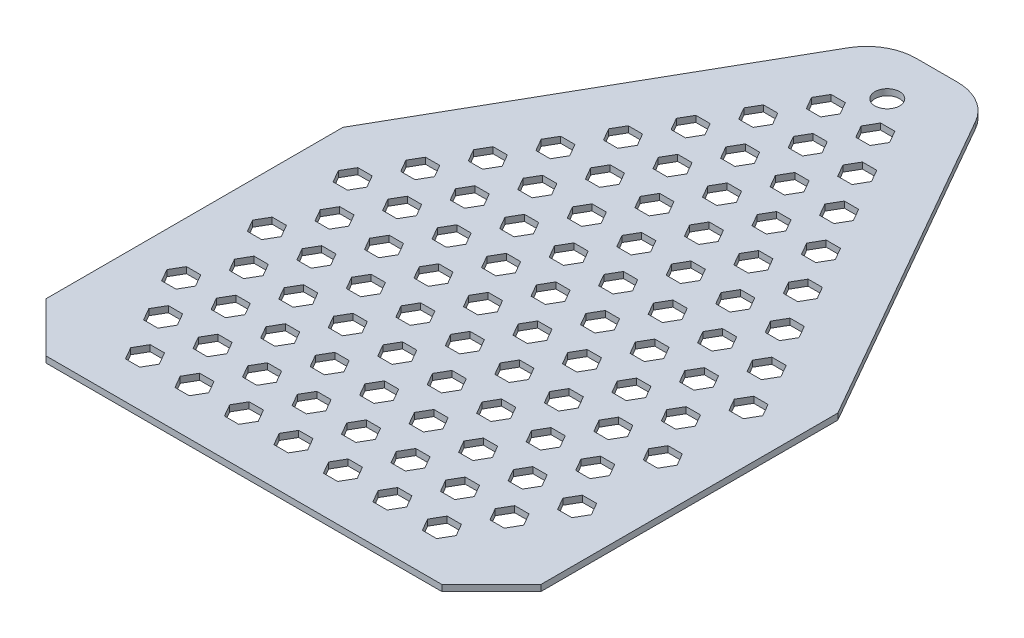
from build123d import *

# Parameters (mm, degrees)
BOSS_EXTRUDE1_DEPTH = 1.5875
CUT_EXTRUDE1_REACH  = 190.806
SKETCH2_R           = 3.175
CUT_EXTRUDE2_REACH  = 190.806
FILL_PATTERN1_DEPTH = 1.5875


# Read off the part's stored shape, not the designer's step: Fill Pattern1
with BuildPart() as part:
    # Sketch1 → Boss-Extrude1 (new body)
    with BuildSketch(Plane(origin=(0, 0, 0), x_dir=(1, 0, 0), z_dir=(0, 1, 0))):
        with BuildLine():
            Line((-50.8, 0), (50.8, 0))
            Line((50.8, 0), (63.5, 12.7))
            Line((63.5, 12.7), (63.5, 88.9))
            Line((63.5, 88.9), (16.356591704, 171.400964517))
            ThreePointArc((16.356591704, 171.400964517), (11.704374391, 176.084358183), (5.3299038, 177.8))
            Line((5.3299038, 177.8), (-5.3299038, 177.8))
            ThreePointArc((-5.3299038, 177.8), (-11.704374391, 176.084358183), (-16.356591704, 171.400964517))
            Line((-16.356591704, 171.400964517), (-63.5, 88.9))
            Line((-63.5, 88.9), (-63.5, 12.7))
            Line((-63.5, 12.7), (-50.8, 0))
        make_face()
    extrude(amount=BOSS_EXTRUDE1_DEPTH)

    # Sketch2 → Cut-Extrude1 (cut, up to next)
    with BuildSketch(Plane(origin=(0, 1.5875, 0), x_dir=(1, 0, 0), z_dir=(0, 1, 0)), mode=Mode.PRIVATE) as cut_extrude1_sk1:
        with Locations(Location((0, 165.1, 0), (0, 0, 270))):
            Circle(SKETCH2_R)
    cut_extrude1_tool1 = extrude(cut_extrude1_sk1.sketch, amount=-CUT_EXTRUDE1_REACH, mode=Mode.PRIVATE) & part.part
    add(cut_extrude1_tool1.solids().sort_by_distance((0, 1.5875, -165.1))[0], mode=Mode.SUBTRACT)

    # Sketch3 → Cut-Extrude2 (cut, up to next)
    with BuildSketch(Plane(origin=(0, 1.5875, 0), x_dir=(1, 0, 0), z_dir=(0, 1, 0)), mode=Mode.PRIVATE) as cut_extrude2_sk1:
        Polygon((1.833087105, 9.525), (3.666174209, 12.7), (1.833087105, 15.875), (-1.833087105, 15.875), (-3.666174209, 12.7), (-1.833087105, 9.525), align=None)
    cut_extrude2_tool1 = extrude(cut_extrude2_sk1.sketch, amount=-CUT_EXTRUDE2_REACH, mode=Mode.PRIVATE) & part.part
    add(cut_extrude2_tool1.solids().sort_by_distance((0, 1.5875, -12.7))[0], mode=Mode.SUBTRACT)

    # Fill Pattern1 outline → Fill Pattern1 (cut)
    with BuildSketch(Plane(origin=(0, 0, 0), x_dir=(1, 0, 0), z_dir=(0, 1, 0))):
        Polygon((9.033825791, 12.7), (10.866912895, 9.525), (14.533087105, 9.525), (16.366174209, 12.7), (14.533087105, 15.875), (10.866912895, 15.875), align=None)
        Polygon((34.433825791, 12.7), (36.266912895, 9.525), (39.933087105, 9.525), (41.766174209, 12.7), (39.933087105, 15.875), (36.266912895, 15.875), align=None)
        Polygon((21.733825791, 12.7), (23.566912895, 9.525), (27.233087105, 9.525), (29.066174209, 12.7), (27.233087105, 15.875), (23.566912895, 15.875), align=None)
        Polygon((-29.066174209, 12.7), (-27.233087105, 9.525), (-23.566912895, 9.525), (-21.733825791, 12.7), (-23.566912895, 15.875), (-27.233087105, 15.875), align=None)
        Polygon((-16.366174209, 12.7), (-14.533087105, 9.525), (-10.866912895, 9.525), (-9.033825791, 12.7), (-10.866912895, 15.875), (-14.533087105, 15.875), align=None)
        Polygon((-41.766174209, 12.7), (-39.933087105, 9.525), (-36.266912895, 9.525), (-34.433825791, 12.7), (-36.266912895, 15.875), (-39.933087105, 15.875), align=None)
        Polygon((-33.583087105, 70.86761314), (-35.416174209, 67.69261314), (-33.583087105, 64.51761314), (-29.916912895, 64.51761314), (-28.083825791, 67.69261314), (-29.916912895, 70.86761314), align=None)
        Polygon((-27.233087105, 59.869090512), (-29.066174209, 56.694090512), (-27.233087105, 53.519090512), (-23.566912895, 53.519090512), (-21.733825791, 56.694090512), (-23.566912895, 59.869090512), align=None)
        Polygon((-46.283087105, 92.864658396), (-48.116174209, 89.689658396), (-46.283087105, 86.514658396), (-42.616912895, 86.514658396), (-40.783825791, 89.689658396), (-42.616912895, 92.864658396), align=None)
        Polygon((-39.933087105, 81.866135768), (-41.766174209, 78.691135768), (-39.933087105, 75.516135768), (-36.266912895, 75.516135768), (-34.433825791, 78.691135768), (-36.266912895, 81.866135768), align=None)
        Polygon((-14.533087105, 37.872045256), (-16.366174209, 34.697045256), (-14.533087105, 31.522045256), (-10.866912895, 31.522045256), (-9.033825791, 34.697045256), (-10.866912895, 37.872045256), align=None)
        Polygon((-8.183087105, 26.873522628), (-10.016174209, 23.698522628), (-8.183087105, 20.523522628), (-4.516912895, 20.523522628), (-2.683825791, 23.698522628), (-4.516912895, 26.873522628), align=None)
        Polygon((-20.883087105, 48.870567884), (-22.716174209, 45.695567884), (-20.883087105, 42.520567884), (-17.216912895, 42.520567884), (-15.383825791, 45.695567884), (-17.216912895, 48.870567884), align=None)
        Polygon((46.283087105, 92.864658396), (42.616912895, 92.864658396), (40.783825791, 89.689658396), (42.616912895, 86.514658396), (46.283087105, 86.514658396), (48.116174209, 89.689658396), align=None)
        Polygon((39.933087105, 81.866135768), (36.266912895, 81.866135768), (34.433825791, 78.691135768), (36.266912895, 75.516135768), (39.933087105, 75.516135768), (41.766174209, 78.691135768), align=None)
        Polygon((33.583087105, 70.86761314), (29.916912895, 70.86761314), (28.083825791, 67.69261314), (29.916912895, 64.51761314), (33.583087105, 64.51761314), (35.416174209, 67.69261314), align=None)
        Polygon((27.233087105, 59.869090512), (23.566912895, 59.869090512), (21.733825791, 56.694090512), (23.566912895, 53.519090512), (27.233087105, 53.519090512), (29.066174209, 56.694090512), align=None)
        Polygon((20.883087105, 48.870567884), (17.216912895, 48.870567884), (15.383825791, 45.695567884), (17.216912895, 42.520567884), (20.883087105, 42.520567884), (22.716174209, 45.695567884), align=None)
        Polygon((14.533087105, 37.872045256), (10.866912895, 37.872045256), (9.033825791, 34.697045256), (10.866912895, 31.522045256), (14.533087105, 31.522045256), (16.366174209, 34.697045256), align=None)
        Polygon((8.183087105, 26.873522628), (4.516912895, 26.873522628), (2.683825791, 23.698522628), (4.516912895, 20.523522628), (8.183087105, 20.523522628), (10.016174209, 23.698522628), align=None)
        Polygon((-54.466174209, 78.691135768), (-52.633087105, 75.516135768), (-48.966912895, 75.516135768), (-47.133825791, 78.691135768), (-48.966912895, 81.866135768), (-52.633087105, 81.866135768), align=None)
        Polygon((21.733825791, 78.691135768), (23.566912895, 75.516135768), (27.233087105, 75.516135768), (29.066174209, 78.691135768), (27.233087105, 81.866135768), (23.566912895, 81.866135768), align=None)
        Polygon((47.133825791, 78.691135768), (48.966912895, 75.516135768), (52.633087105, 75.516135768), (54.466174209, 78.691135768), (52.633087105, 81.866135768), (48.966912895, 81.866135768), align=None)
        Polygon((-29.066174209, 78.691135768), (-27.233087105, 75.516135768), (-23.566912895, 75.516135768), (-21.733825791, 78.691135768), (-23.566912895, 81.866135768), (-27.233087105, 81.866135768), align=None)
        Polygon((9.033825791, 78.691135768), (10.866912895, 75.516135768), (14.533087105, 75.516135768), (16.366174209, 78.691135768), (14.533087105, 81.866135768), (10.866912895, 81.866135768), align=None)
        Polygon((-16.366174209, 78.691135768), (-14.533087105, 75.516135768), (-10.866912895, 75.516135768), (-9.033825791, 78.691135768), (-10.866912895, 81.866135768), (-14.533087105, 81.866135768), align=None)
        Polygon((-3.666174209, 78.691135768), (-1.833087105, 75.516135768), (1.833087105, 75.516135768), (3.666174209, 78.691135768), (1.833087105, 81.866135768), (-1.833087105, 81.866135768), align=None)
        Polygon((-39.933087105, 59.869090512), (-41.766174209, 56.694090512), (-39.933087105, 53.519090512), (-36.266912895, 53.519090512), (-34.433825791, 56.694090512), (-36.266912895, 59.869090512), align=None)
        Polygon((-33.583087105, 48.870567884), (-35.416174209, 45.695567884), (-33.583087105, 42.520567884), (-29.916912895, 42.520567884), (-28.083825791, 45.695567884), (-29.916912895, 48.870567884), align=None)
        Polygon((-46.283087105, 70.86761314), (-48.116174209, 67.69261314), (-46.283087105, 64.51761314), (-42.616912895, 64.51761314), (-40.783825791, 67.69261314), (-42.616912895, 70.86761314), align=None)
        Polygon((-20.883087105, 26.873522628), (-22.716174209, 23.698522628), (-20.883087105, 20.523522628), (-17.216912895, 20.523522628), (-15.383825791, 23.698522628), (-17.216912895, 26.873522628), align=None)
        Polygon((-27.233087105, 37.872045256), (-29.066174209, 34.697045256), (-27.233087105, 31.522045256), (-23.566912895, 31.522045256), (-21.733825791, 34.697045256), (-23.566912895, 37.872045256), align=None)
        Polygon((-17.216912895, 136.858748909), (-20.883087105, 136.858748909), (-22.716174209, 133.683748909), (-20.883087105, 130.508748909), (-17.216912895, 130.508748909), (-15.383825791, 133.683748909), align=None)
        Polygon((-10.866912895, 147.857271537), (-14.533087105, 147.857271537), (-16.366174209, 144.682271537), (-14.533087105, 141.507271537), (-10.866912895, 141.507271537), (-9.033825791, 144.682271537), align=None)
        Polygon((-4.516912895, 158.855794165), (-8.183087105, 158.855794165), (-10.016174209, 155.680794165), (-8.183087105, 152.505794165), (-4.516912895, 152.505794165), (-2.683825791, 155.680794165), align=None)
        Polygon((-23.566912895, 125.860226281), (-27.233087105, 125.860226281), (-29.066174209, 122.685226281), (-27.233087105, 119.510226281), (-23.566912895, 119.510226281), (-21.733825791, 122.685226281), align=None)
        Polygon((-29.916912895, 114.861703653), (-33.583087105, 114.861703653), (-35.416174209, 111.686703653), (-33.583087105, 108.511703653), (-29.916912895, 108.511703653), (-28.083825791, 111.686703653), align=None)
        Polygon((-36.266912895, 103.863181024), (-39.933087105, 103.863181024), (-41.766174209, 100.688181024), (-39.933087105, 97.513181024), (-36.266912895, 97.513181024), (-34.433825791, 100.688181024), align=None)
        Polygon((28.083825791, 45.695567884), (29.916912895, 42.520567884), (33.583087105, 42.520567884), (35.416174209, 45.695567884), (33.583087105, 48.870567884), (29.916912895, 48.870567884), align=None)
        Polygon((40.783825791, 45.695567884), (42.616912895, 42.520567884), (46.283087105, 42.520567884), (48.116174209, 45.695567884), (46.283087105, 48.870567884), (42.616912895, 48.870567884), align=None)
        Polygon((-48.116174209, 45.695567884), (-46.283087105, 42.520567884), (-42.616912895, 42.520567884), (-40.783825791, 45.695567884), (-42.616912895, 48.870567884), (-46.283087105, 48.870567884), align=None)
        Polygon((-10.016174209, 45.695567884), (-8.183087105, 42.520567884), (-4.516912895, 42.520567884), (-2.683825791, 45.695567884), (-4.516912895, 48.870567884), (-8.183087105, 48.870567884), align=None)
        Polygon((2.683825791, 45.695567884), (4.516912895, 42.520567884), (8.183087105, 42.520567884), (10.016174209, 45.695567884), (8.183087105, 48.870567884), (4.516912895, 48.870567884), align=None)
        Polygon((17.216912895, 70.86761314), (15.383825791, 67.69261314), (17.216912895, 64.51761314), (20.883087105, 64.51761314), (22.716174209, 67.69261314), (20.883087105, 70.86761314), align=None)
        Polygon((42.616912895, 26.873522628), (40.783825791, 23.698522628), (42.616912895, 20.523522628), (46.283087105, 20.523522628), (48.116174209, 23.698522628), (46.283087105, 26.873522628), align=None)
        Polygon((36.266912895, 37.872045256), (34.433825791, 34.697045256), (36.266912895, 31.522045256), (39.933087105, 31.522045256), (41.766174209, 34.697045256), (39.933087105, 37.872045256), align=None)
        Polygon((-8.183087105, 114.861703653), (-10.016174209, 111.686703653), (-8.183087105, 108.511703653), (-4.516912895, 108.511703653), (-2.683825791, 111.686703653), (-4.516912895, 114.861703653), align=None)
        Polygon((-14.533087105, 125.860226281), (-16.366174209, 122.685226281), (-14.533087105, 119.510226281), (-10.866912895, 119.510226281), (-9.033825791, 122.685226281), (-10.866912895, 125.860226281), align=None)
        Polygon((-1.833087105, 103.863181024), (-3.666174209, 100.688181024), (-1.833087105, 97.513181024), (1.833087105, 97.513181024), (3.666174209, 100.688181024), (1.833087105, 103.863181024), align=None)
        Polygon((4.516912895, 92.864658396), (2.683825791, 89.689658396), (4.516912895, 86.514658396), (8.183087105, 86.514658396), (10.016174209, 89.689658396), (8.183087105, 92.864658396), align=None)
        Polygon((27.233087105, 37.872045256), (23.566912895, 37.872045256), (21.733825791, 34.697045256), (23.566912895, 31.522045256), (27.233087105, 31.522045256), (29.066174209, 34.697045256), align=None)
        Polygon((20.883087105, 26.873522628), (17.216912895, 26.873522628), (15.383825791, 23.698522628), (17.216912895, 20.523522628), (20.883087105, 20.523522628), (22.716174209, 23.698522628), align=None)
        Polygon((46.283087105, 70.86761314), (42.616912895, 70.86761314), (40.783825791, 67.69261314), (42.616912895, 64.51761314), (46.283087105, 64.51761314), (48.116174209, 67.69261314), align=None)
        Polygon((39.933087105, 59.869090512), (36.266912895, 59.869090512), (34.433825791, 56.694090512), (36.266912895, 53.519090512), (39.933087105, 53.519090512), (41.766174209, 56.694090512), align=None)
        Polygon((47.133825791, 34.697045256), (48.966912895, 31.522045256), (52.633087105, 31.522045256), (54.466174209, 34.697045256), (52.633087105, 37.872045256), (48.966912895, 37.872045256), align=None)
        Polygon((-54.466174209, 34.697045256), (-52.633087105, 31.522045256), (-48.966912895, 31.522045256), (-47.133825791, 34.697045256), (-48.966912895, 37.872045256), (-52.633087105, 37.872045256), align=None)
        Polygon((-41.766174209, 34.697045256), (-39.933087105, 31.522045256), (-36.266912895, 31.522045256), (-34.433825791, 34.697045256), (-36.266912895, 37.872045256), (-39.933087105, 37.872045256), align=None)
        Polygon((-3.666174209, 34.697045256), (-1.833087105, 31.522045256), (1.833087105, 31.522045256), (3.666174209, 34.697045256), (1.833087105, 37.872045256), (-1.833087105, 37.872045256), align=None)
        Polygon((10.866912895, 59.869090512), (9.033825791, 56.694090512), (10.866912895, 53.519090512), (14.533087105, 53.519090512), (16.366174209, 56.694090512), (14.533087105, 59.869090512), align=None)
        Polygon((29.916912895, 26.873522628), (28.083825791, 23.698522628), (29.916912895, 20.523522628), (33.583087105, 20.523522628), (35.416174209, 23.698522628), (33.583087105, 26.873522628), align=None)
        Polygon((-14.533087105, 103.863181024), (-16.366174209, 100.688181024), (-14.533087105, 97.513181024), (-10.866912895, 97.513181024), (-9.033825791, 100.688181024), (-10.866912895, 103.863181024), align=None)
        Polygon((-20.883087105, 114.861703653), (-22.716174209, 111.686703653), (-20.883087105, 108.511703653), (-17.216912895, 108.511703653), (-15.383825791, 111.686703653), (-17.216912895, 114.861703653), align=None)
        Polygon((4.516912895, 70.86761314), (2.683825791, 67.69261314), (4.516912895, 64.51761314), (8.183087105, 64.51761314), (10.016174209, 67.69261314), (8.183087105, 70.86761314), align=None)
        Polygon((-8.183087105, 92.864658396), (-10.016174209, 89.689658396), (-8.183087105, 86.514658396), (-4.516912895, 86.514658396), (-2.683825791, 89.689658396), (-4.516912895, 92.864658396), align=None)
        Polygon((-48.116174209, 23.698522628), (-46.283087105, 20.523522628), (-42.616912895, 20.523522628), (-40.783825791, 23.698522628), (-42.616912895, 26.873522628), (-46.283087105, 26.873522628), align=None)
        Polygon((-35.416174209, 23.698522628), (-33.583087105, 20.523522628), (-29.916912895, 20.523522628), (-28.083825791, 23.698522628), (-29.916912895, 26.873522628), (-33.583087105, 26.873522628), align=None)
        Polygon((-20.883087105, 92.864658396), (-22.716174209, 89.689658396), (-20.883087105, 86.514658396), (-17.216912895, 86.514658396), (-15.383825791, 89.689658396), (-17.216912895, 92.864658396), align=None)
        Polygon((-27.233087105, 103.863181024), (-29.066174209, 100.688181024), (-27.233087105, 97.513181024), (-23.566912895, 97.513181024), (-21.733825791, 100.688181024), (-23.566912895, 103.863181024), align=None)
        Polygon((-1.833087105, 59.869090512), (-3.666174209, 56.694090512), (-1.833087105, 53.519090512), (1.833087105, 53.519090512), (3.666174209, 56.694090512), (1.833087105, 59.869090512), align=None)
        Polygon((-8.183087105, 70.86761314), (-10.016174209, 67.69261314), (-8.183087105, 64.51761314), (-4.516912895, 64.51761314), (-2.683825791, 67.69261314), (-4.516912895, 70.86761314), align=None)
        Polygon((-33.583087105, 92.864658396), (-35.416174209, 89.689658396), (-33.583087105, 86.514658396), (-29.916912895, 86.514658396), (-28.083825791, 89.689658396), (-29.916912895, 92.864658396), align=None)
        Polygon((-20.883087105, 70.86761314), (-22.716174209, 67.69261314), (-20.883087105, 64.51761314), (-17.216912895, 64.51761314), (-15.383825791, 67.69261314), (-17.216912895, 70.86761314), align=None)
        Polygon((-14.533087105, 59.869090512), (-16.366174209, 56.694090512), (-14.533087105, 53.519090512), (-10.866912895, 53.519090512), (-9.033825791, 56.694090512), (-10.866912895, 59.869090512), align=None)
        Polygon((28.083825791, 89.689658396), (29.916912895, 86.514658396), (33.583087105, 86.514658396), (35.416174209, 89.689658396), (33.583087105, 92.864658396), (29.916912895, 92.864658396), align=None)
        Polygon((15.383825791, 89.689658396), (17.216912895, 86.514658396), (20.883087105, 86.514658396), (22.716174209, 89.689658396), (20.883087105, 92.864658396), (17.216912895, 92.864658396), align=None)
        Polygon((36.266912895, 103.863181024), (34.433825791, 100.688181024), (36.266912895, 97.513181024), (39.933087105, 97.513181024), (41.766174209, 100.688181024), (39.933087105, 103.863181024), align=None)
        Polygon((4.516912895, 158.855794165), (2.683825791, 155.680794165), (4.516912895, 152.505794165), (8.183087105, 152.505794165), (10.016174209, 155.680794165), (8.183087105, 158.855794165), align=None)
        Polygon((10.866912895, 147.857271537), (9.033825791, 144.682271537), (10.866912895, 141.507271537), (14.533087105, 141.507271537), (16.366174209, 144.682271537), (14.533087105, 147.857271537), align=None)
        Polygon((23.566912895, 125.860226281), (21.733825791, 122.685226281), (23.566912895, 119.510226281), (27.233087105, 119.510226281), (29.066174209, 122.685226281), (27.233087105, 125.860226281), align=None)
        Polygon((29.916912895, 114.861703653), (28.083825791, 111.686703653), (29.916912895, 108.511703653), (33.583087105, 108.511703653), (35.416174209, 111.686703653), (33.583087105, 114.861703653), align=None)
        Polygon((17.216912895, 136.858748909), (15.383825791, 133.683748909), (17.216912895, 130.508748909), (20.883087105, 130.508748909), (22.716174209, 133.683748909), (20.883087105, 136.858748909), align=None)
        Polygon((48.966912895, 59.869090512), (47.133825791, 56.694090512), (48.966912895, 53.519090512), (52.633087105, 53.519090512), (54.466174209, 56.694090512), (52.633087105, 59.869090512), align=None)
        Polygon((4.516912895, 136.858748909), (2.683825791, 133.683748909), (4.516912895, 130.508748909), (8.183087105, 130.508748909), (10.016174209, 133.683748909), (8.183087105, 136.858748909), align=None)
        Polygon((-1.833087105, 147.857271537), (-3.666174209, 144.682271537), (-1.833087105, 141.507271537), (1.833087105, 141.507271537), (3.666174209, 144.682271537), (1.833087105, 147.857271537), align=None)
        Polygon((17.216912895, 114.861703653), (15.383825791, 111.686703653), (17.216912895, 108.511703653), (20.883087105, 108.511703653), (22.716174209, 111.686703653), (20.883087105, 114.861703653), align=None)
        Polygon((23.566912895, 103.863181024), (21.733825791, 100.688181024), (23.566912895, 97.513181024), (27.233087105, 97.513181024), (29.066174209, 100.688181024), (27.233087105, 103.863181024), align=None)
        Polygon((10.866912895, 125.860226281), (9.033825791, 122.685226281), (10.866912895, 119.510226281), (14.533087105, 119.510226281), (16.366174209, 122.685226281), (14.533087105, 125.860226281), align=None)
        Polygon((-1.833087105, 125.860226281), (-3.666174209, 122.685226281), (-1.833087105, 119.510226281), (1.833087105, 119.510226281), (3.666174209, 122.685226281), (1.833087105, 125.860226281), align=None)
        Polygon((-8.183087105, 136.858748909), (-10.016174209, 133.683748909), (-8.183087105, 130.508748909), (-4.516912895, 130.508748909), (-2.683825791, 133.683748909), (-4.516912895, 136.858748909), align=None)
        Polygon((4.516912895, 114.861703653), (2.683825791, 111.686703653), (4.516912895, 108.511703653), (8.183087105, 108.511703653), (10.016174209, 111.686703653), (8.183087105, 114.861703653), align=None)
        Polygon((10.866912895, 103.863181024), (9.033825791, 100.688181024), (10.866912895, 97.513181024), (14.533087105, 97.513181024), (16.366174209, 100.688181024), (14.533087105, 103.863181024), align=None)
        Polygon((-54.466174209, 56.694090512), (-52.633087105, 53.519090512), (-48.966912895, 53.519090512), (-47.133825791, 56.694090512), (-48.966912895, 59.869090512), (-52.633087105, 59.869090512), align=None)
    extrude(amount=FILL_PATTERN1_DEPTH, mode=Mode.SUBTRACT)


solid = part.part
